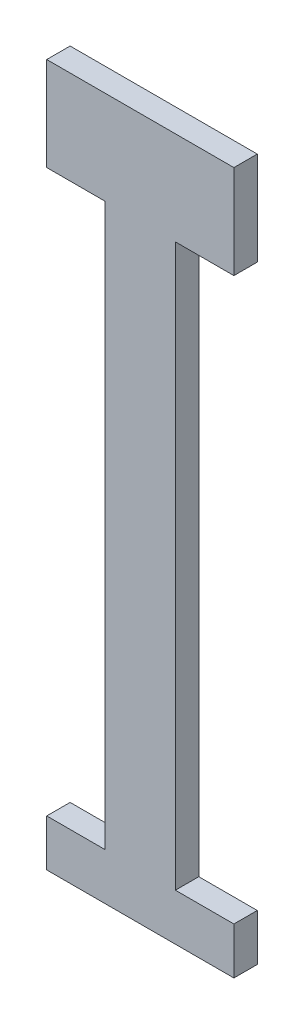
from build123d import *

# Parameters (mm, degrees)
EXTRUDE1_DEPTH = 3.175


with BuildPart() as part:
    # Sketch1 → Extrude1 (new body)
    with BuildSketch(Plane.XY):
        Polygon((-7.9375, 0), (0, 0), (0, 76.2), (-7.9375, 76.2), (-7.9375, 88.9), (17.4625, 88.9), (17.4625, 76.2), (9.525, 76.2), (9.525, 0), (17.4625, 0), (17.4625, -6.35), (-7.9375, -6.35), align=None)
    extrude(amount=EXTRUDE1_DEPTH)


solid = part.part
